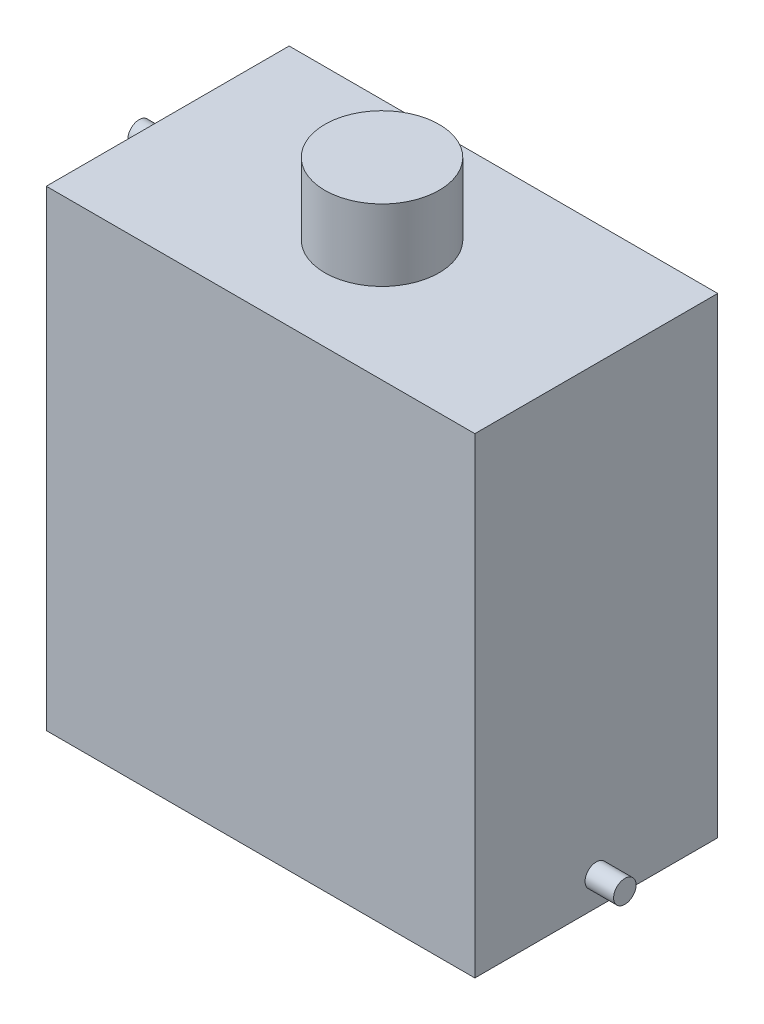
from build123d import *

# Parameters (mm, degrees)
SKETCH1_W           = 190.5
SKETCH1_H           = 107.95
BOSS_EXTRUDE1_DEPTH = 209.55
SKETCH2_R           = 25.4
BOSS_EXTRUDE2_DEPTH = 31.75
SKETCH3_R           = 5
BOSS_EXTRUDE3_DEPTH = 12.7
SKETCH5_R           = 5
BOSS_EXTRUDE4_DEPTH = 12.7


with BuildPart() as part:
    # Sketch1 → Boss-Extrude1 (new body)
    with BuildSketch(Plane(origin=(0, 0, 0), x_dir=(1, 0, 0), z_dir=(0, 1, 0))):
        Rectangle(SKETCH1_W, SKETCH1_H)
    extrude(amount=BOSS_EXTRUDE1_DEPTH)

    # Sketch2 → Boss-Extrude2 (add)
    with BuildSketch(Plane(origin=(0, 209.55, 0), x_dir=(1, 0, 0), z_dir=(0, 1, 0))):
        Circle(SKETCH2_R)
    extrude(amount=BOSS_EXTRUDE2_DEPTH)

    # Sketch3 → Boss-Extrude3 (add)
    with BuildSketch(Plane.ZY.offset(95.25)):
        with Locations((0, 196.85)):
            Circle(SKETCH3_R)
    extrude(amount=BOSS_EXTRUDE3_DEPTH)

    # Sketch5 → Boss-Extrude4 (add)
    with BuildSketch(Plane(origin=(95.25, 0, 0), x_dir=(0, 0, -1), z_dir=(1, 0, 0))):
        with Locations((0, 12.7)):
            Circle(SKETCH5_R)
    extrude(amount=BOSS_EXTRUDE4_DEPTH)


solid = part.part
